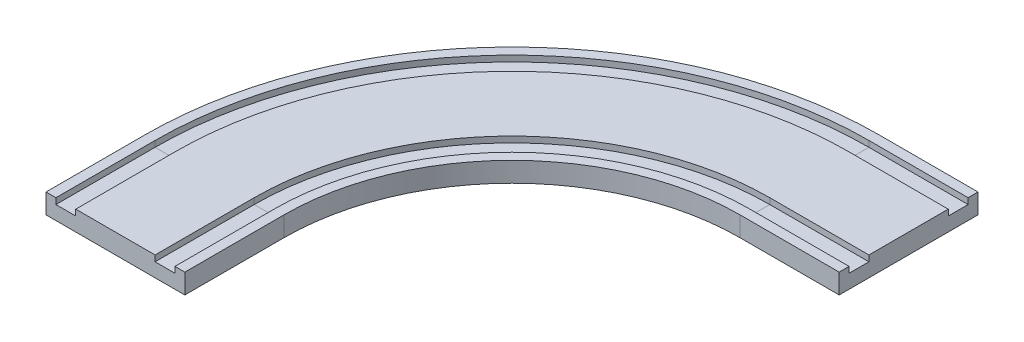
from build123d import *

# Parameters (mm, degrees)
BOSS_EXTRUDE1_DEPTH = 10
CUT_SWEEP1_START    = 7
CUT_SWEEP1_DEPTH    = 3


# Read off the part's stored shape, not the designer's step: Cut-Sweep1
with BuildPart() as part:
    # Sketch1 → Boss-Extrude1 (new body)
    with BuildSketch(Plane(origin=(0, 0, 0), x_dir=(1, 0, 0), z_dir=(0, 1, 0))):
        with BuildLine():
            Line((-35, 0), (35, 0))
            Line((35, 0), (35, 50))
            ThreePointArc((35, 50), (68.682720164, 131.317279836), (150, 165))
            Line((150, 165), (200, 165))
            Line((200, 165), (200, 235))
            Line((200, 235), (150, 235))
            ThreePointArc((150, 235), (19.18524548, 180.81475452), (-35, 50))
            Line((-35, 50), (-35, 0))
        make_face()
    extrude(amount=BOSS_EXTRUDE1_DEPTH)

    # Cut-Sweep1 outline → Cut-Sweep1 (cut)
    with BuildSketch(Plane(origin=(0, 0, 0), x_dir=(1, 0, 0), z_dir=(0, 1, 0)).offset(CUT_SWEEP1_START)):
        with BuildLine():
            Line((-30, 50), (-30, 0))
            Line((-30, 0), (-20, 0))
            Line((-20, 0), (-20, 50))
            ThreePointArc((-20, 50), (29.791847198, 170.208152802), (150, 220))
            Line((150, 220), (200, 220))
            Line((200, 220), (200, 230))
            Line((200, 230), (150, 230))
            ThreePointArc((150, 230), (22.720779386, 177.279220614), (-30, 50))
        make_face()
        with BuildLine():
            Line((20, 50), (20, 0))
            Line((20, 0), (30, 0))
            Line((30, 0), (30, 50))
            ThreePointArc((30, 50), (65.147186258, 134.852813742), (150, 170))
            Line((150, 170), (200, 170))
            Line((200, 170), (200, 180))
            Line((200, 180), (150, 180))
            ThreePointArc((150, 180), (58.076118446, 141.923881554), (20, 50))
        make_face()
    extrude(amount=CUT_SWEEP1_DEPTH, mode=Mode.SUBTRACT)


solid = part.part
